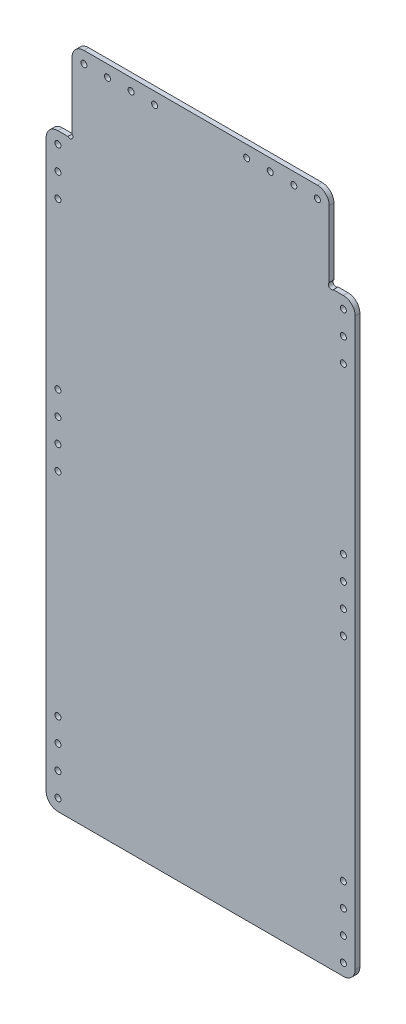
from build123d import *

# Parameters (mm, degrees)
SKETCH1_R           = 2.55
BOSS_EXTRUDE1_DEPTH = 4
FILLET1_R           = 10


with BuildPart() as part:
    # Sketch1 → Boss-Extrude1 (new body)
    with BuildSketch(Plane.XY):
        with BuildLine():
            Line((112.535533906, 500), (131, 500))
            Line((131, 500), (131, 0))
            Line((131, 0), (-131, 0))
            Line((-131, 0), (-131, 500))
            Line((-131, 500), (-112.535533906, 500))
            ThreePointArc((-112.535533906, 500), (-109, 500), (-109, 503.535533906))
            Line((-109, 503.535533906), (-109, 570))
            Line((-109, 570), (109, 570))
            Line((109, 570), (109, 503.535533906))
            ThreePointArc((109, 503.535533906), (109, 500), (112.535533906, 500))
        make_face()
        with Locations((-121, 10)):
            Circle(SKETCH1_R, mode=Mode.SUBTRACT)
        with Locations((-121, 30)):
            Circle(SKETCH1_R, mode=Mode.SUBTRACT)
        with Locations((-121, 50)):
            Circle(SKETCH1_R, mode=Mode.SUBTRACT)
        with Locations((-121, 70)):
            Circle(SKETCH1_R, mode=Mode.SUBTRACT)
        with Locations((-121, 250)):
            Circle(SKETCH1_R, mode=Mode.SUBTRACT)
        with Locations((-121, 270)):
            Circle(SKETCH1_R, mode=Mode.SUBTRACT)
        with Locations((-121, 290)):
            Circle(SKETCH1_R, mode=Mode.SUBTRACT)
        with Locations((-121, 310)):
            Circle(SKETCH1_R, mode=Mode.SUBTRACT)
        with Locations((-121, 450)):
            Circle(SKETCH1_R, mode=Mode.SUBTRACT)
        with Locations((-121, 470)):
            Circle(SKETCH1_R, mode=Mode.SUBTRACT)
        with Locations((-121, 490)):
            Circle(SKETCH1_R, mode=Mode.SUBTRACT)
        with Locations((-99, 560)):
            Circle(SKETCH1_R, mode=Mode.SUBTRACT)
        with Locations((-79, 560)):
            Circle(SKETCH1_R, mode=Mode.SUBTRACT)
        with Locations((-59, 560)):
            Circle(SKETCH1_R, mode=Mode.SUBTRACT)
        with Locations((-39, 560)):
            Circle(SKETCH1_R, mode=Mode.SUBTRACT)
        with Locations((121, 10)):
            Circle(SKETCH1_R, mode=Mode.SUBTRACT)
        with Locations((121, 490)):
            Circle(SKETCH1_R, mode=Mode.SUBTRACT)
        with Locations((121, 470)):
            Circle(SKETCH1_R, mode=Mode.SUBTRACT)
        with Locations((121, 450)):
            Circle(SKETCH1_R, mode=Mode.SUBTRACT)
        with Locations((121, 310)):
            Circle(SKETCH1_R, mode=Mode.SUBTRACT)
        with Locations((121, 290)):
            Circle(SKETCH1_R, mode=Mode.SUBTRACT)
        with Locations((121, 270)):
            Circle(SKETCH1_R, mode=Mode.SUBTRACT)
        with Locations((121, 250)):
            Circle(SKETCH1_R, mode=Mode.SUBTRACT)
        with Locations((121, 70)):
            Circle(SKETCH1_R, mode=Mode.SUBTRACT)
        with Locations((121, 50)):
            Circle(SKETCH1_R, mode=Mode.SUBTRACT)
        with Locations((121, 30)):
            Circle(SKETCH1_R, mode=Mode.SUBTRACT)
        with Locations((39, 560)):
            Circle(SKETCH1_R, mode=Mode.SUBTRACT)
        with Locations((59, 560)):
            Circle(SKETCH1_R, mode=Mode.SUBTRACT)
        with Locations((79, 560)):
            Circle(SKETCH1_R, mode=Mode.SUBTRACT)
        with Locations((99, 560)):
            Circle(SKETCH1_R, mode=Mode.SUBTRACT)
    extrude(amount=BOSS_EXTRUDE1_DEPTH)

    # Fillet1
    fillet1_edges = [part.edges().sort_by_distance(p)[0] for p in [
        (-131, 0, 2),
        (131, 0, 2),
        (131, 500, 2),
        (109, 570, 2),
        (-109, 570, 2),
        (-131, 500, 2),
    ]]
    fillet(fillet1_edges, radius=FILLET1_R)


solid = part.part
